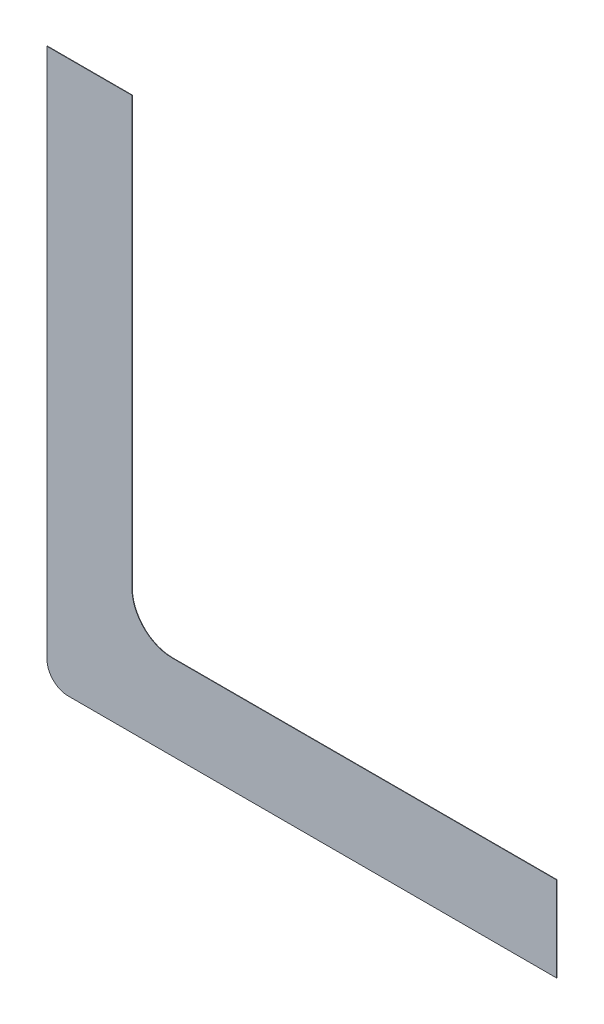
from build123d import *

# Parameters (mm, degrees)
EXTRUDE_1_DEPTH = 0.1
FILLET_1_R      = 9.5
FILLET_2_R      = 5


with BuildPart() as part:
    # 草图1 → 凸台-拉伸1 (new body)
    with BuildSketch(Plane.XY):
        Polygon((0, 0), (-120, 0), (-120, 130), (-100, 130), (-100, 20), (0, 20), align=None)
    extrude(amount=EXTRUDE_1_DEPTH)

    # 圆角1
    fillet_1_edges = [part.edges().sort_by_distance(p)[0] for p in [
        (-100, 20, 0.05),
    ]]
    fillet(fillet_1_edges, radius=FILLET_1_R)

    # 圆角2
    fillet_2_edges = [part.edges().sort_by_distance(p)[0] for p in [
        (-120, 0, 0.05),
    ]]
    fillet(fillet_2_edges, radius=FILLET_2_R)


solid = part.part
